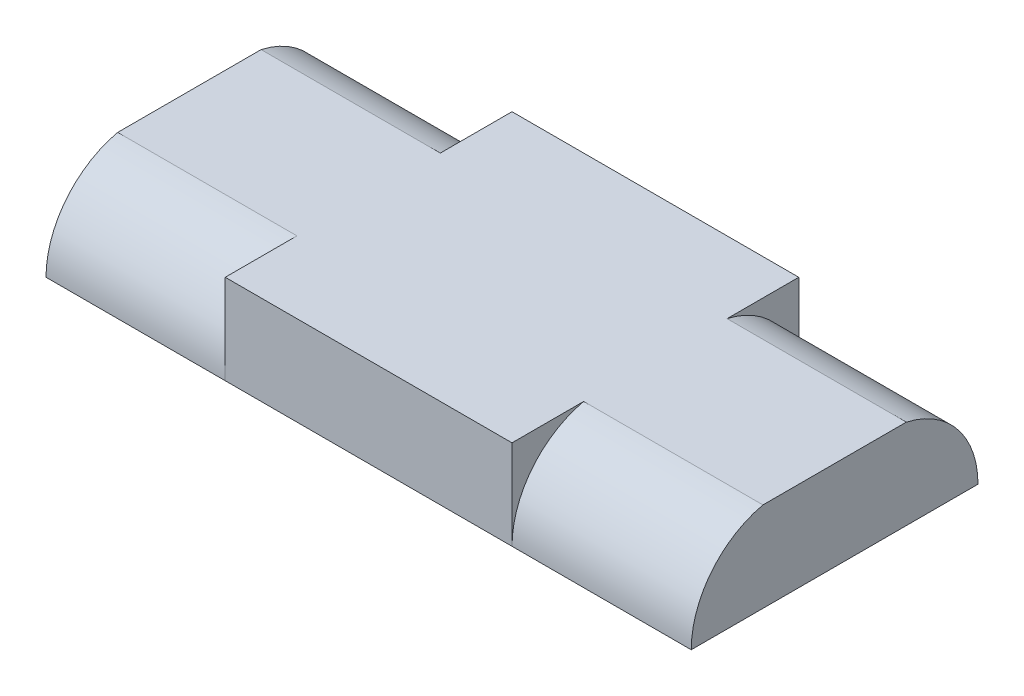
from build123d import *

# Parameters (mm, degrees)
SKETCH1_W           = 16
SKETCH1_H           = 16
BOSS_EXTRUDE1_DEPTH = 5
SHELL1_T            = -1
SKETCH2_R           = 2.7
SKETCH2_R_2         = 1.7
BOSS_EXTRUDE2_DEPTH = 4
SKETCH3_W           = 8
SKETCH3_H           = 5
BOSS_EXTRUDE3_DEPTH = 10
SKETCH4_W           = 8
SKETCH4_H           = 5
BOSS_EXTRUDE4_DEPTH = 10
SHELL2_START        = -17
SHELL2_OUTLINE_W    = 4
SHELL2_OUTLINE_H    = 6
SHELL2_DEPTH        = 9
SHELL2_START_2      = 8
SHELL2_2_OUTLINE_W  = 4
SHELL2_2_OUTLINE_H  = 6
SHELL2_2_DEPTH      = 9
BOSS_EXTRUDE5_DEPTH = 10


# Read off the part's stored shape, not the designer's step: Shell2
with BuildPart() as part:
    # Sketch1 → Boss-Extrude1 (new body)
    with BuildSketch(Plane(origin=(0, 0, 0), x_dir=(1, 0, 0), z_dir=(0, 1, 0))):
        Rectangle(SKETCH1_W, SKETCH1_H)
    extrude(amount=BOSS_EXTRUDE1_DEPTH)

    # Shell1
    shell1_openings = [part.faces().sort_by_distance(p)[0] for p in [
        (0, 0, 0),
    ]]
    offset(amount=SHELL1_T, openings=shell1_openings, kind=Kind.INTERSECTION)

    # Sketch2 → Boss-Extrude2 (add)
    with BuildSketch(Plane.XZ.offset(-4)):
        with Locations(Location((0, 0, 0), (0, 0, 90))):
            Circle(SKETCH2_R)
        with Locations(Location((0, 0, 0), (0, 0, 90))):
            Circle(SKETCH2_R_2, mode=Mode.SUBTRACT)
    extrude(amount=BOSS_EXTRUDE2_DEPTH)

    # Sketch3 → Boss-Extrude3 (add)
    with BuildSketch(Plane.ZY.offset(8)):
        with Locations((0, 2.5)):
            Rectangle(SKETCH3_W, SKETCH3_H)
    extrude(amount=BOSS_EXTRUDE3_DEPTH)

    # Sketch4 → Boss-Extrude4 (add)
    with BuildSketch(Plane(origin=(8, 0, 0), x_dir=(0, 0, -1), z_dir=(1, 0, 0))):
        with Locations((0, 2.5)):
            Rectangle(SKETCH4_W, SKETCH4_H)
    extrude(amount=BOSS_EXTRUDE4_DEPTH)

    # Shell2 outline → Shell2 (cut)
    with BuildSketch(Plane.YZ.offset(SHELL2_START)):
        with Locations((2, 0)):
            Rectangle(SHELL2_OUTLINE_W, SHELL2_OUTLINE_H)
    extrude(amount=SHELL2_DEPTH, mode=Mode.SUBTRACT)

    # Shell2 2 outline → Shell2 2 (cut)
    with BuildSketch(Plane.YZ.offset(SHELL2_START_2)):
        with Locations((2, 0)):
            Rectangle(SHELL2_2_OUTLINE_W, SHELL2_2_OUTLINE_H)
    extrude(amount=SHELL2_2_DEPTH, mode=Mode.SUBTRACT)

    # Sketch5 → Boss-Extrude5 (add)
    with BuildSketch(Plane(origin=(8, 0, 0), x_dir=(0, 0, -1), z_dir=(1, 0, 0))):
        with BuildLine():
            Line((4, 0), (8, 0))
            ThreePointArc((8, 0), (6.876952648, 3.201562119), (4, 5))
            Line((4, 5), (4, 0))
        make_face()
        with BuildLine():
            Line((-4, 0), (-8, 0))
            ThreePointArc((-8, 0), (-6.876952648, 3.201562119), (-4, 5))
            Line((-4, 5), (-4, 0))
        make_face()
    boss_extrude5 = extrude(amount=BOSS_EXTRUDE5_DEPTH)

    # Mirror2: Boss-Extrude5 across plane
    add(boss_extrude5.mirror(Plane(origin=(0, 0, 0), x_dir=(0, 0, 1), z_dir=(1, 0, 0))))


solid = part.part
